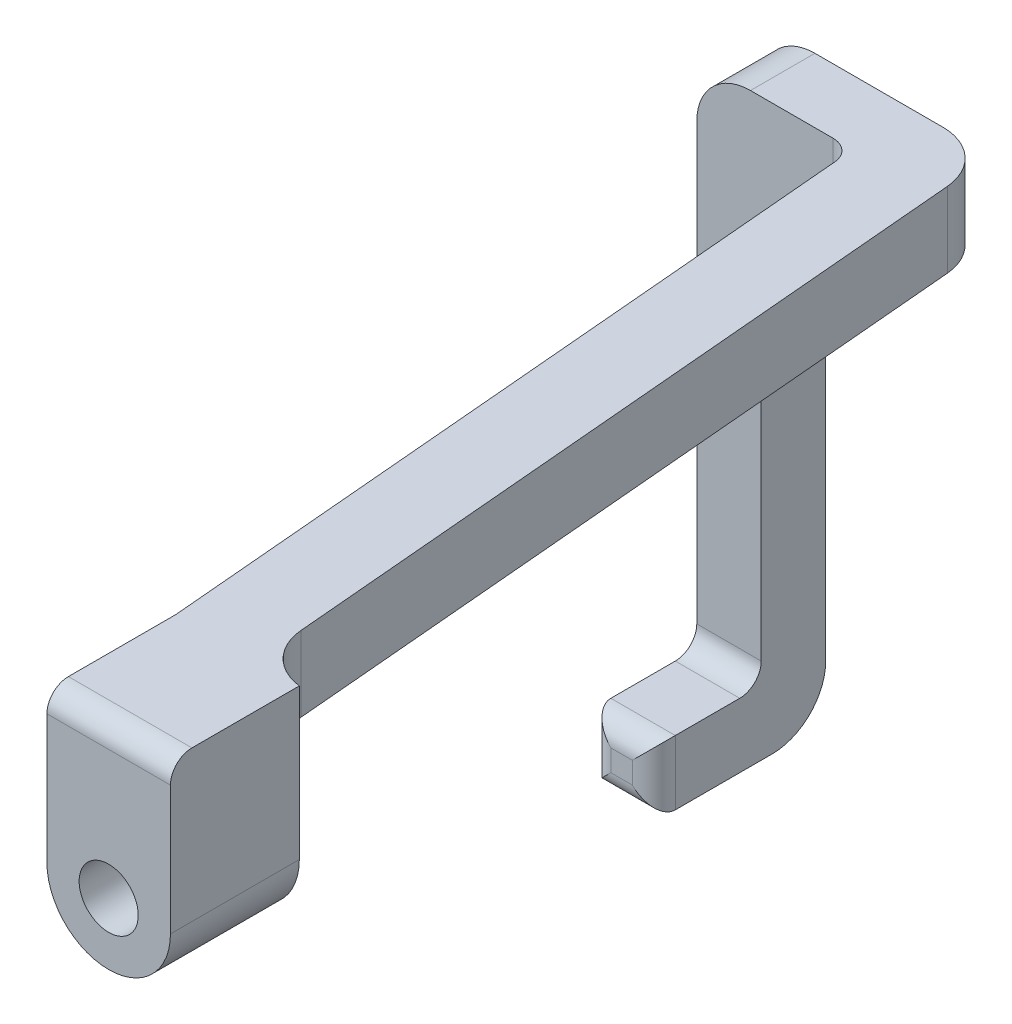
from build123d import *

# Parameters (mm, degrees)
SKETCH1_R           = 1.375
BOSS_EXTRUDE1_DEPTH = 6
BOSS_EXTRUDE2_START = -13.125
SKETCH9_W           = 3.5
SKETCH9_H           = 3
BOSS_EXTRUDE2_DEPTH = 7.26
BOSS_EXTRUDE3_START = -26.75
SKETCH10_W          = 3
SKETCH10_H          = 3
BOSS_EXTRUDE3_DEPTH = 23.25
SKETCH11_W          = 3
SKETCH11_H          = 3
BOSS_EXTRUDE4_DEPTH = 5
FILLET1_R           = 2.5
FILLET2_R           = 1


with BuildPart() as part:
    # Sketch1 → Boss-Extrude1 (new body)
    with BuildSketch(Plane(origin=(0, 0, 0), x_dir=(0, 1, 0), z_dir=(0, 0, 1))):
        with BuildLine():
            Line((0, 2.875), (7, 2.875))
            Line((7, 2.875), (7, -2.875))
            Line((7, -2.875), (0, -2.875))
            ThreePointArc((0, -2.875), (-2.875, 0), (0, 2.875))
        make_face()
        with Locations(Location((0, 0, 0), (0, 0, 270))):
            Circle(SKETCH1_R, mode=Mode.SUBTRACT)
    extrude(amount=BOSS_EXTRUDE1_DEPTH)

    # Sketch2 → Loft1 section 0
    with BuildSketch(Plane(origin=(0, 0, 0), x_dir=(1, 0, 0), z_dir=(0, 0, -1))):
        with BuildLine():
            Line((0.875, -7), (-2.875, -7))
            Line((-2.875, -7), (-2.875, -3.5))
            Line((-2.875, -3.5), (0.875, -3.5))
            Line((0.875, -3.5), (0.875, -7))
        make_face()
    # Sketch8 → Loft1 section 1
    with BuildSketch(Plane(origin=(0, 0, -37.5), x_dir=(-1, 0, 0), z_dir=(0, 0, -1))):
        with BuildLine():
            Line((2.375, 3.5), (2.375, 7))
            Line((2.375, 7), (6.125, 7))
            Line((6.125, 7), (6.125, 3.5))
            Line((6.125, 3.5), (2.375, 3.5))
        make_face()
    loft()

    # Sketch9 → Boss-Extrude2 (add)
    with BuildSketch(Plane.YZ.offset(BOSS_EXTRUDE2_START)):
        with Locations((5.25, -36)):
            Rectangle(SKETCH9_W, SKETCH9_H)
    extrude(amount=BOSS_EXTRUDE2_DEPTH)

    # Sketch10 → Boss-Extrude3 (add)
    with BuildSketch(Plane(origin=(0, 7, 0), x_dir=(-1, 0, 0), z_dir=(0, 1, 0)).offset(BOSS_EXTRUDE3_START)):
        with Locations((11.625, -36)):
            Rectangle(SKETCH10_W, SKETCH10_H)
    extrude(amount=BOSS_EXTRUDE3_DEPTH)

    # Sketch11 → Boss-Extrude4 (add)
    with BuildSketch(Plane.XY.offset(-34.5)):
        with Locations((-11.625, -18.25)):
            Rectangle(SKETCH11_W, SKETCH11_H)
    extrude(amount=BOSS_EXTRUDE4_DEPTH)

    # Fillet1
    # the kernel refuses this fillet: 2.5 mm, written as the material it adds along each edge
    with BuildSketch(Plane(origin=(-10.125, 3.5, -37.5), x_dir=(1, 0, 0), z_dir=(0, 0, 1))) as fillet1_piece_1:
        with BuildLine():
            CenterArc((FILLET1_R, -FILLET1_R), FILLET1_R, 90, 90)
            Line((0, -FILLET1_R), (0, 0))
            Line((0, 0), (FILLET1_R, 0))
        make_face()
    extrude(amount=3)
    with BuildSketch(Plane(origin=(0.875, 3.5, 0), x_dir=(-0.08634300732914678, 0, -0.9962654691824658), z_dir=(0, 1, 0))) as fillet1_piece_2:
        with BuildLine():
            CenterArc((2.275267243, -2.5), FILLET1_R, 90, 78.288278187)
            Line((-0.172686015, -1.992530938), (0, 0))
            Line((0, 0), (2.275267243, 0))
        make_face()
    extrude(amount=3.5)
    # the kernel refuses this fillet: 2.5 mm, written as the material it takes off along each edge
    with BuildSketch(Plane(origin=(-2.375, -2.231761645, -37.5), x_dir=(-1, 0, 0), z_dir=(0, 1, 0))) as fillet1_2_piece_1:
        with BuildLine():
            CenterArc((FILLET1_R * 0.917081863151, FILLET1_R), FILLET1_R, 184.953257478, 85.046742522)
            Line((-FILLET1_R * 0.0791836060315, FILLET1_R * 0.913656992671), (0, 0))
            Line((0, 0), (FILLET1_R * 0.917081863151, 0))
        make_face()
    extrude(amount=14.963523289, mode=Mode.SUBTRACT)
    with BuildSketch(Plane(origin=(-13.125, 7, -43.75), x_dir=(0, -1, 0), z_dir=(0, 0, 1))) as fillet1_2_piece_2:
        with BuildLine():
            CenterArc((FILLET1_R, FILLET1_R), FILLET1_R, 180, 90)
            Line((0, FILLET1_R), (0, 0))
            Line((0, 0), (FILLET1_R, 0))
        make_face()
    extrude(amount=15.5, mode=Mode.SUBTRACT)
    with BuildSketch(Plane(origin=(-19.375, -19.75, -37.5), x_dir=(0, 0, 1), z_dir=(1, 0, 0))) as fillet1_2_piece_3:
        with BuildLine():
            CenterArc((FILLET1_R, -FILLET1_R), FILLET1_R, 90, 90)
            Line((0, -FILLET1_R), (0, 0))
            Line((0, 0), (FILLET1_R, 0))
        make_face()
    extrude(amount=15.5, mode=Mode.SUBTRACT)

    # Fillet2
    fillet2_edges = [part.edges().sort_by_distance(p)[0] for p in [
        (0, 7, 6),
        (-5.865, 5.25, -34.5),
        (-11.625, -16.75, -34.5),
        (-11.625, -16.75, -29.5),
        (-13.125, -18.25, -29.5),
        (-11.625, -19.75, -29.5),
        (-10.125, -18.25, -29.5),
    ]]
    fillet(fillet2_edges, radius=FILLET2_R)


solid = part.part
